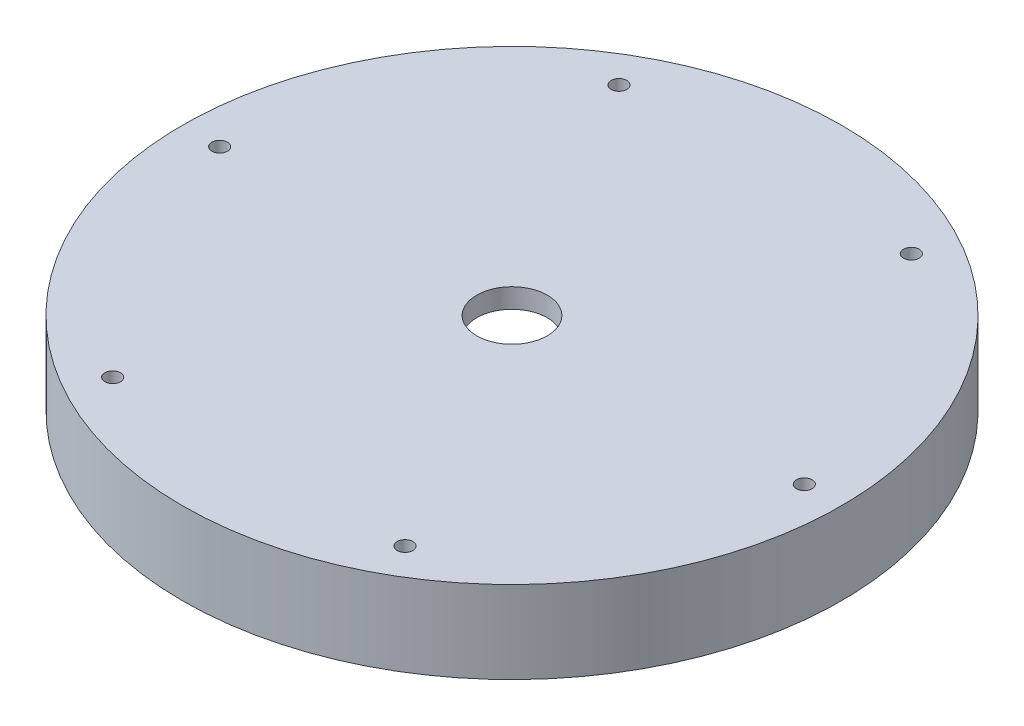
from build123d import *

# Parameters (mm, degrees)
SKETCH2_R          = 1
CUT_EXTRUDE1_DEPTH = 61.600043832


with BuildPart() as part:
    # Sketch1 → Revolve1 (revolve)
    with BuildSketch(Plane.XY):
        Polygon((-4.5, 0), (-42.0375, 0), (-42.0375, -10.5), (-39.0375, -10.5), (-39.0375, -11.75), (-20, -11.75), (-20, -2.5), (-4.5, -2.5), align=None)
    revolve(axis=Axis((0, 38.708668819, 0), (0, -1, 0)))

    # Sketch2 → Cut-Extrude1 (cut, through all)
    with BuildSketch(Plane.XZ.offset(11.75)):
        with Locations((-37.2875, 0)):
            Circle(SKETCH2_R)
        with Locations((-18.64375, 32.291922244)):
            Circle(SKETCH2_R)
        with Locations((18.64375, 32.291922244)):
            Circle(SKETCH2_R)
        with Locations((37.2875, 0)):
            Circle(SKETCH2_R)
        with Locations((18.64375, -32.291922244)):
            Circle(SKETCH2_R)
        with Locations((-18.64375, -32.291922244)):
            Circle(SKETCH2_R)
    extrude(amount=-CUT_EXTRUDE1_DEPTH, mode=Mode.SUBTRACT)


solid = part.part
